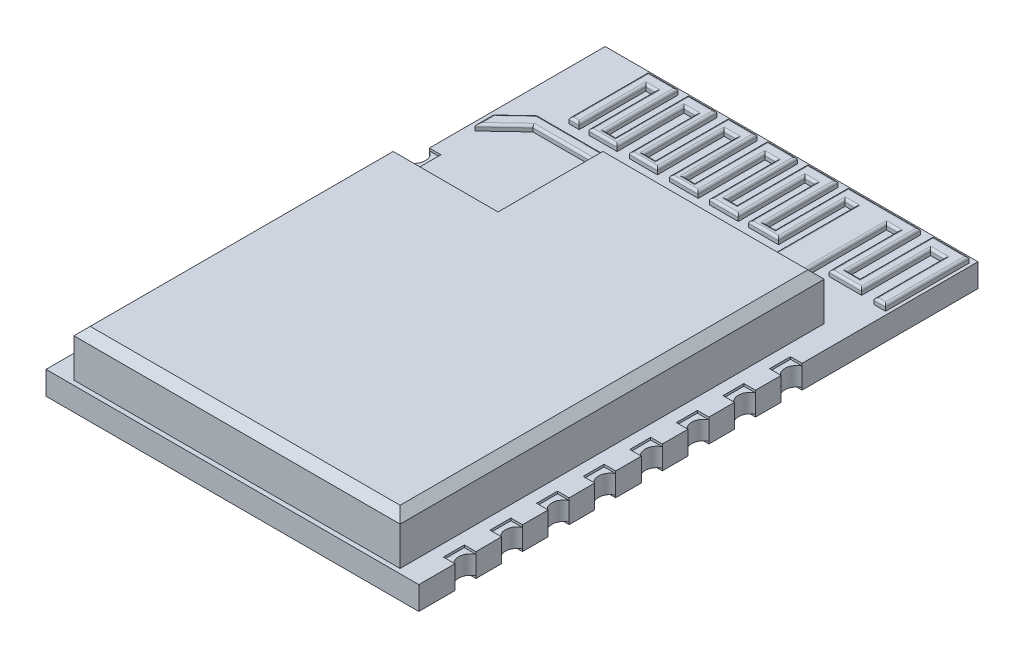
from build123d import *

# Parameters (mm, degrees)
EXTRUDE_1_DEPTH     = 1
CUT_EXTRUDE_1_DEPTH = 0.1
SKETCH_3_W          = 0.9999999999999991
SKETCH_3_H          = 0.9000000000000012
SKETCH_3_H_2        = 0.9000000000000021
SKETCH_3_W_2        = 1.0000000000000009
SKETCH_3_H_3        = 0.9000000000000017
SKETCH_3_H_4        = 0.9000000000000015
CUT_EXTRUDE_2_DEPTH = 0.1
CUT_EXTRUDE_3_DEPTH = 0.1
SKETCH_12_R         = 0.2
SKETCH_12_R_2       = 0.20000000000000023
SKETCH_12_R_3       = 0.1999999999999999
SKETCH_12_R_4       = 0.2000000000000001
SKETCH_12_R_5       = 0.19999999999999996
SKETCH_12_R_6       = 0.20000000000000007
CUT_EXTRUDE_4_DEPTH = 0.1
SKETCH_13_W         = 4.700000000000001
SKETCH_13_H         = 4.7
EXTRUDE_2_DEPTH     = 0.5
CUT_EXTRUDE_5_DEPTH = 0.1
SKETCH_16_R         = 0.2
SKETCH_16_R_2       = 0.19999999999999982
SKETCH_16_R_3       = 0.20000000000000004
SKETCH_16_R_4       = 0.19999999999999998
CUT_EXTRUDE_6_DEPTH = 0.25
EXTRUDE_4_DEPTH     = 2
CUT_EXTRUDE_7_DEPTH = 2
SKETCH_19_W         = 14
SKETCH_19_H         = 1.002469933908639
EXTRUDE_5_DEPTH     = 2
EXTRUDE_7_DEPTH     = 0.25
FILLET_4_R          = 0.1
CHAMFER_1_SIZE      = 0.35


with BuildPart() as part:
    # 草圖1 → 填料-伸長1 (new body)
    with BuildSketch(Plane(origin=(0, 0, 0), x_dir=(1, 0, 0), z_dir=(0, 1, 0))):
        Polygon((-8, 12.000000000000002), (8, 12.000000000000002), (8.000000000000004, -11.999999999999998), (-7.9999999999999964, -11.999999999999998), align=None)
    extrude(amount=EXTRUDE_1_DEPTH)

    # 草圖2 → 除料-伸長1 (cut)
    with BuildSketch(Plane(origin=(0, 1, 0), x_dir=(1, 0, 0), z_dir=(0, 1, 0))):
        Polygon((-7.999999999999998, 2.4499977713717627), (-7.999999999999998, 1.5499977713717676), (-7.502985717330638, 1.5499977713717659), (-7.502985717330638, 2.449997771371764), align=None)
        Polygon((-7.999999999999998, 0.44999777137176267), (-7.999999999999998, -0.45000222862823236), (-7.502985717330638, -0.4500022286282341), (-7.502985717330638, 0.44999777137176394), align=None)
        Polygon((-7.999999999999998, -1.5500022286282373), (-7.999999999999998, -2.4500022286282324), (-7.502985717330637, -2.450002228628234), (-7.502985717330637, -1.550002228628236), align=None)
        Polygon((-7.999999999999997, -3.5500022286282373), (-7.999999999999997, -4.450002228628234), (-7.502985717330637, -4.450002228628234), (-7.502985717330637, -3.550002228628236), align=None)
        Polygon((-7.999999999999997, -5.550002228628239), (-7.999999999999997, -6.450002228628234), (-7.502985717330637, -6.450002228628234), (-7.502985717330637, -5.5500022286282364), align=None)
        Polygon((-7.999999999999997, -7.550002228628239), (-7.999999999999997, -8.450002228628234), (-7.5029857173306365, -8.450002228628234), (-7.5029857173306365, -7.5500022286282364), align=None)
        Polygon((-7.5029857173306365, -9.550002228628236), (-7.9999999999999964, -9.550002228628237), (-7.9999999999999964, -10.450002228628234), (-7.5029857173306365, -10.450002228628234), align=None)
        Polygon((7.5029857173306365, -10.450002228628234), (8.000000000000004, -10.450002228628232), (8.000000000000004, -9.550002228628237), (7.5029857173306365, -9.550002228628236), align=None)
        Polygon((7.5029857173306365, -8.450002228628234), (8.000000000000004, -8.450002228628232), (8.000000000000004, -7.550002228628238), (7.5029857173306365, -7.5500022286282364), align=None)
        Polygon((7.502985717330636, -6.450002228628234), (8.000000000000004, -6.450002228628232), (8.000000000000002, -5.550002228628238), (7.502985717330636, -5.5500022286282364), align=None)
        Polygon((7.502985717330636, -4.450002228628234), (8.000000000000002, -4.450002228628232), (8.000000000000002, -3.5500022286282373), (7.502985717330636, -3.550002228628236), align=None)
        Polygon((7.502985717330636, -2.450002228628234), (8.000000000000002, -2.4500022286282324), (8.000000000000002, -1.5500022286282373), (7.502985717330636, -1.550002228628236), align=None)
        Polygon((7.502985717330635, -0.4500022286282341), (8.000000000000002, -0.45000222862823236), (8.000000000000002, 0.44999777137176267), (7.502985717330635, 0.44999777137176394), align=None)
        Polygon((7.502985717330635, 3.549997771371766), (8.000000000000002, 3.5499977713717676), (8.000000000000002, 4.449997771371764), (7.502985717330635, 4.449997771371764), align=None)
        Polygon((7.502985717330635, 1.5499977713717659), (8.000000000000002, 1.5499977713717676), (8.000000000000002, 2.4499977713717627), (7.502985717330635, 2.449997771371764), align=None)
        Polygon((-7.502985717330638, 4.449997771371764), (-7.502985717330638, 3.549997771371766), (-8.002985717330638, 3.5499977713717676), (-8.002985717330638, 4.449997771371763), align=None)
    extrude(amount=-CUT_EXTRUDE_1_DEPTH, mode=Mode.SUBTRACT)

    # 草圖3 → 除料-伸長2 (cut)
    with BuildSketch(Plane.XZ):
        with Locations((7.5000000000000036, 7.999999999999998)):
            Rectangle(SKETCH_3_W, SKETCH_3_H)
        with Locations((7.5000000000000036, 9.999999999999998)):
            Rectangle(SKETCH_3_W, SKETCH_3_H_2)
        with Locations((7.5000000000000036, 5.999999999999998)):
            Rectangle(SKETCH_3_W_2, SKETCH_3_H)
        with Locations((7.5000000000000036, 3.9999999999999982)):
            Rectangle(SKETCH_3_W_2, SKETCH_3_H_3)
        with Locations((7.500000000000002, 1.9999999999999982)):
            Rectangle(SKETCH_3_W, SKETCH_3_H)
        with Locations((7.500000000000002, -1.75e-15)):
            Rectangle(SKETCH_3_W, SKETCH_3_H_4)
        with Locations((7.500000000000002, -2.0000000000000018)):
            Rectangle(SKETCH_3_W, SKETCH_3_H)
        with Locations((7.500000000000002, -4.000000000000002)):
            Rectangle(SKETCH_3_W, SKETCH_3_H_2)
        with Locations((-7.5000000000000036, 9.999999999999998)):
            Rectangle(SKETCH_3_W, SKETCH_3_H_2)
        with Locations((-7.500000000000002, -4.000000000000002)):
            Rectangle(SKETCH_3_W, SKETCH_3_H_2)
        with Locations((-7.500000000000002, -2.0000000000000018)):
            Rectangle(SKETCH_3_W, SKETCH_3_H)
        with Locations((-7.500000000000002, -1.75e-15)):
            Rectangle(SKETCH_3_W, SKETCH_3_H_4)
        with Locations((-7.500000000000002, 1.9999999999999982)):
            Rectangle(SKETCH_3_W, SKETCH_3_H)
        with Locations((-7.5000000000000036, 3.9999999999999982)):
            Rectangle(SKETCH_3_W_2, SKETCH_3_H_3)
        with Locations((-7.5000000000000036, 5.999999999999998)):
            Rectangle(SKETCH_3_W_2, SKETCH_3_H)
        with Locations((-7.5000000000000036, 7.999999999999998)):
            Rectangle(SKETCH_3_W, SKETCH_3_H)
    extrude(amount=-CUT_EXTRUDE_2_DEPTH, mode=Mode.SUBTRACT)

    # 草圖8 → 除料-伸長3 (cut)
    with BuildSketch(Plane(origin=(0, 1, 0), x_dir=(1, 0, 0), z_dir=(0, 1, 0))):
        Polygon((-0.9999999999999989, 0.6000000000000024), (3.7000000000000015, 0.6000000000000024), (3.700000000000002, -4.099999999999998), (-0.9999999999999983, -4.099999999999998), align=None)
    extrude(amount=-CUT_EXTRUDE_3_DEPTH, mode=Mode.SUBTRACT)

    # 草圖12 → 除料-伸長4 (cut)
    with BuildSketch(Plane(origin=(0, 0.9, 0), x_dir=(1, 0, 0), z_dir=(0, 1, 0))):
        with Locations(Location((-0.5099999999999989, -3.6499999999999977, 0), (0, 0, 270))):
            Circle(SKETCH_12_R)
        with Locations(Location((0.4200000000000011, -3.6499999999999977, 0), (0, 0, 270))):
            Circle(SKETCH_12_R)
        with Locations(Location((1.3500000000000012, -3.6499999999999977, 0), (0, 0, 270))):
            Circle(SKETCH_12_R)
        with Locations(Location((2.2800000000000007, -3.6499999999999977, 0), (0, 0, 270))):
            Circle(SKETCH_12_R_2)
        with Locations(Location((3.210000000000001, -3.6499999999999977, 0), (0, 0, 270))):
            Circle(SKETCH_12_R_2)
        with Locations(Location((-0.509999999999999, -2.7199999999999975, 0), (0, 0, 270))):
            Circle(SKETCH_12_R_3)
        with Locations(Location((0.420000000000001, -2.7199999999999975, 0), (0, 0, 270))):
            Circle(SKETCH_12_R_3)
        with Locations(Location((1.350000000000001, -2.7199999999999975, 0), (0, 0, 270))):
            Circle(SKETCH_12_R_3)
        with Locations(Location((2.2800000000000007, -2.7199999999999975, 0), (0, 0, 270))):
            Circle(SKETCH_12_R_4)
        with Locations(Location((3.210000000000001, -2.7199999999999975, 0), (0, 0, 270))):
            Circle(SKETCH_12_R_4)
        with Locations(Location((-0.5099999999999991, -1.7899999999999978, 0), (0, 0, 270))):
            Circle(SKETCH_12_R_5)
        with Locations(Location((0.4200000000000008, -1.7899999999999978, 0), (0, 0, 270))):
            Circle(SKETCH_12_R_6)
        with Locations(Location((1.350000000000001, -1.7899999999999978, 0), (0, 0, 270))):
            Circle(SKETCH_12_R)
        with Locations(Location((2.2800000000000002, -1.7899999999999978, 0), (0, 0, 270))):
            Circle(SKETCH_12_R_2)
        with Locations(Location((3.2100000000000004, -1.7899999999999978, 0), (0, 0, 270))):
            Circle(SKETCH_12_R_2)
        with Locations(Location((-0.5099999999999993, -0.8599999999999979, 0), (0, 0, 270))):
            Circle(SKETCH_12_R_6)
        with Locations(Location((0.4200000000000007, -0.8599999999999979, 0), (0, 0, 270))):
            Circle(SKETCH_12_R_5)
        with Locations(Location((1.3500000000000008, -0.8599999999999979, 0), (0, 0, 270))):
            Circle(SKETCH_12_R)
        with Locations(Location((2.2800000000000002, -0.8599999999999979, 0), (0, 0, 270))):
            Circle(SKETCH_12_R_2)
        with Locations(Location((3.2100000000000004, -0.8599999999999979, 0), (0, 0, 270))):
            Circle(SKETCH_12_R_2)
        with Locations(Location((-0.5099999999999995, 0.07000000000000235, 0), (0, 0, 270))):
            Circle(SKETCH_12_R_6)
        with Locations(Location((0.4200000000000006, 0.07000000000000235, 0), (0, 0, 270))):
            Circle(SKETCH_12_R_5)
        with Locations(Location((1.3500000000000008, 0.07000000000000235, 0), (0, 0, 270))):
            Circle(SKETCH_12_R)
        with Locations(Location((2.2800000000000002, 0.07000000000000235, 0), (0, 0, 270))):
            Circle(SKETCH_12_R_2)
        with Locations(Location((3.2100000000000004, 0.07000000000000235, 0), (0, 0, 270))):
            Circle(SKETCH_12_R_2)
    extrude(amount=-CUT_EXTRUDE_4_DEPTH, mode=Mode.SUBTRACT)

    # 草圖13 → 填料-伸長2 (add)
    with BuildSketch(Plane(origin=(0, 1, 0), x_dir=(1, 0, 0), z_dir=(0, 1, 0))):
        with Locations((1.3500000000000016, -1.7499999999999978)):
            Rectangle(SKETCH_13_W, SKETCH_13_H)
    extrude(amount=-EXTRUDE_2_DEPTH)

    # 草圖15 → 除料-伸長5 (cut)
    with BuildSketch(Plane.XZ):
        Polygon((1.0000000000000018, -0.6000000000000014), (-3.6999999999999984, -0.6000000000000021), (-3.6999999999999984, 4.099999999999997), (1.000000000000002, 4.099999999999998), align=None)
    extrude(amount=-CUT_EXTRUDE_5_DEPTH, mode=Mode.SUBTRACT)

    # 草圖16 → 除料-伸長6 (cut)
    with BuildSketch(Plane.XZ):
        with Locations(Location((0.5100000000000018, 3.6099999999999977, 0), (0, 0, 270))):
            Circle(SKETCH_16_R)
        with Locations(Location((-0.41999999999999826, 3.6099999999999977, 0), (0, 0, 270))):
            Circle(SKETCH_16_R)
        with Locations(Location((-1.3499999999999983, 3.609999999999997, 0), (0, 0, 270))):
            Circle(SKETCH_16_R)
        with Locations(Location((-2.279999999999998, 3.609999999999997, 0), (0, 0, 270))):
            Circle(SKETCH_16_R_2)
        with Locations(Location((-3.2099999999999986, 3.6099999999999968, 0), (0, 0, 270))):
            Circle(SKETCH_16_R_2)
        with Locations(Location((-3.2099999999999986, 2.679999999999997, 0), (0, 0, 270))):
            Circle(SKETCH_16_R_2)
        with Locations(Location((-2.279999999999998, 2.6799999999999975, 0), (0, 0, 270))):
            Circle(SKETCH_16_R_2)
        with Locations(Location((-1.3499999999999983, 2.6799999999999975, 0), (0, 0, 270))):
            Circle(SKETCH_16_R)
        with Locations(Location((-0.4199999999999983, 2.679999999999998, 0), (0, 0, 270))):
            Circle(SKETCH_16_R)
        with Locations(Location((0.5100000000000018, 2.679999999999998, 0), (0, 0, 270))):
            Circle(SKETCH_16_R)
        with Locations(Location((-3.2099999999999986, 1.749999999999997, 0), (0, 0, 270))):
            Circle(SKETCH_16_R_2)
        with Locations(Location((-2.279999999999998, 1.7499999999999973, 0), (0, 0, 270))):
            Circle(SKETCH_16_R_2)
        with Locations(Location((-1.3499999999999983, 1.7499999999999973, 0), (0, 0, 270))):
            Circle(SKETCH_16_R)
        with Locations(Location((-0.4199999999999984, 1.7499999999999978, 0), (0, 0, 270))):
            Circle(SKETCH_16_R_3)
        with Locations(Location((0.5100000000000017, 1.7499999999999978, 0), (0, 0, 270))):
            Circle(SKETCH_16_R)
        with Locations(Location((-3.2099999999999986, 0.819999999999997, 0), (0, 0, 270))):
            Circle(SKETCH_16_R_2)
        with Locations(Location((-2.279999999999998, 0.8199999999999974, 0), (0, 0, 270))):
            Circle(SKETCH_16_R_2)
        with Locations(Location((-1.3499999999999985, 0.8199999999999974, 0), (0, 0, 270))):
            Circle(SKETCH_16_R)
        with Locations(Location((-0.4199999999999984, 0.8199999999999978, 0), (0, 0, 270))):
            Circle(SKETCH_16_R_4)
        with Locations(Location((0.5100000000000017, 0.8199999999999978, 0), (0, 0, 270))):
            Circle(SKETCH_16_R)
        with Locations(Location((-3.2099999999999986, -0.11000000000000289, 0), (0, 0, 270))):
            Circle(SKETCH_16_R_2)
        with Locations(Location((-2.279999999999998, -0.11000000000000246, 0), (0, 0, 270))):
            Circle(SKETCH_16_R_2)
        with Locations(Location((-1.3499999999999985, -0.11000000000000246, 0), (0, 0, 270))):
            Circle(SKETCH_16_R)
        with Locations(Location((-0.41999999999999843, -0.11000000000000203, 0), (0, 0, 270))):
            Circle(SKETCH_16_R)
        with Locations(Location((0.5100000000000016, -0.11000000000000203, 0), (0, 0, 270))):
            Circle(SKETCH_16_R)
    extrude(amount=-CUT_EXTRUDE_6_DEPTH, mode=Mode.SUBTRACT)

    # 草圖17 → 填料-伸長4 (add)
    with BuildSketch(Plane(origin=(0, 1, 0), x_dir=(1, 0, 0), z_dir=(0, 1, 0))):
        Polygon((-2.500000000000001, 6.400000000000003), (7.000000000000003, 6.400000000000002), (7.000000000000003, -10.799999999999999), (-6.999999999999997, -10.799999999999999), (-6.999999999999999, 1.400000000000001), (-6.999999999999999, 1.9000000000000024), (-2.5000000000000004, 1.9000000000000032), align=None)
    extrude(amount=EXTRUDE_4_DEPTH)

    # 草圖18 → 除料-伸長7 (cut)
    with BuildSketch(Plane(origin=(0, 1, 0), x_dir=(1, 0, 0), z_dir=(0, 1, 0))):
        with BuildLine():
            Line((-8, 4.449997771371763), (-7.999999999999998, 3.549997771371766))
            ThreePointArc((-7.999999999999998, 3.549997771371766), (-7.717944947177037, 3.999997771371765), (-8, 4.449997771371763))
        make_face()
        with BuildLine():
            Line((-8, 2.4499977713717622), (-7.999999999999998, 1.5499977713717659))
            ThreePointArc((-7.999999999999998, 1.5499977713717659), (-7.717944947177038, 1.999997771371765), (-8, 2.4499977713717622))
        make_face()
        with BuildLine():
            Line((-8, 0.4499977713717622), (-7.999999999999998, -0.4500022286282341))
            ThreePointArc((-7.999999999999998, -0.4500022286282341), (-7.717944947177038, -2.22862823506e-06), (-8, 0.4499977713717622))
        make_face()
        with BuildLine():
            Line((-8, -1.5500022286282378), (-7.999999999999998, -2.450002228628234))
            ThreePointArc((-7.999999999999998, -2.450002228628234), (-7.717944947177037, -2.0000022286282353), (-8, -1.5500022286282378))
        make_face()
        with BuildLine():
            Line((-8, -3.5500022286282378), (-7.999999999999998, -4.450002228628234))
            ThreePointArc((-7.999999999999998, -4.450002228628234), (-7.717944947177038, -4.000002228628235), (-8, -3.5500022286282378))
        make_face()
        with BuildLine():
            Line((-8, -5.550002228628238), (-7.999999999999998, -6.450002228628234))
            ThreePointArc((-7.999999999999998, -6.450002228628234), (-7.717944947177038, -6.000002228628235), (-8, -5.550002228628238))
        make_face()
        with BuildLine():
            Line((-8, -7.550002228628238), (-7.999999999999998, -8.450002228628234))
            ThreePointArc((-7.999999999999998, -8.450002228628234), (-7.717944947177037, -8.000002228628235), (-8, -7.550002228628238))
        make_face()
        with BuildLine():
            Line((-8, -9.550002228628237), (-7.999999999999998, -10.450002228628234))
            ThreePointArc((-7.999999999999998, -10.450002228628234), (-7.717944947177038, -10.000002228628235), (-8, -9.550002228628237))
        make_face()
        with BuildLine():
            Line((8, 4.449997771371763), (7.999999999999998, 3.549997771371766))
            ThreePointArc((7.999999999999998, 3.549997771371766), (7.717944947177037, 3.999997771371765), (8, 4.449997771371763))
        make_face()
        with BuildLine():
            Line((8, 2.4499977713717622), (7.999999999999998, 1.5499977713717659))
            ThreePointArc((7.999999999999998, 1.5499977713717659), (7.717944947177038, 1.999997771371765), (8, 2.4499977713717622))
        make_face()
        with BuildLine():
            Line((8, 0.4499977713717622), (7.999999999999998, -0.4500022286282341))
            ThreePointArc((7.999999999999998, -0.4500022286282341), (7.717944947177038, -2.228628235e-06), (8, 0.4499977713717622))
        make_face()
        with BuildLine():
            Line((8, -1.5500022286282378), (7.999999999999998, -2.450002228628234))
            ThreePointArc((7.999999999999998, -2.450002228628234), (7.717944947177037, -2.0000022286282353), (8, -1.5500022286282378))
        make_face()
        with BuildLine():
            Line((8, -3.5500022286282378), (7.999999999999998, -4.450002228628234))
            ThreePointArc((7.999999999999998, -4.450002228628234), (7.717944947177038, -4.000002228628235), (8, -3.5500022286282378))
        make_face()
        with BuildLine():
            Line((8, -5.550002228628238), (7.999999999999998, -6.450002228628234))
            ThreePointArc((7.999999999999998, -6.450002228628234), (7.717944947177038, -6.000002228628235), (8, -5.550002228628238))
        make_face()
        with BuildLine():
            Line((8, -7.550002228628238), (7.999999999999998, -8.450002228628234))
            ThreePointArc((7.999999999999998, -8.450002228628234), (7.717944947177037, -8.000002228628235), (8, -7.550002228628238))
        make_face()
        with BuildLine():
            Line((8, -9.550002228628237), (7.999999999999998, -10.450002228628234))
            ThreePointArc((7.999999999999998, -10.450002228628234), (7.717944947177038, -10.000002228628235), (8, -9.550002228628237))
        make_face()
    extrude(amount=-CUT_EXTRUDE_7_DEPTH, mode=Mode.SUBTRACT)

    # 草圖19 → 填料-伸長5 (add)
    with BuildSketch(Plane(origin=(0, 1, 0), x_dir=(1, 0, 0), z_dir=(0, 1, 0))):
        with Locations((2.22e-15, -11.301234966954318)):
            Rectangle(SKETCH_19_W, SKETCH_19_H)
    extrude(amount=EXTRUDE_5_DEPTH)

    # 草圖20 → 填料-伸長7 (add)
    with BuildSketch(Plane(origin=(0, 1, 0), x_dir=(1, 0, 0), z_dir=(0, 1, 0))):
        Polygon((2.7745772280204366, 7.299411594104662), (2.774577228020436, 6.400000000000003), (2.2500000000000013, 6.400000000000003), (2.2333276157297033, 7.273314493037537), (-6.374311063944464, 7.2733144930375415), (-7.5709253757125925, 6.142787441828224), (-7.65515008486728, 6.06321434033413), (-7.65515008486728, 6.074907724951117), (-7.65515008486728, 6.142787441828224), (-7.65515008486728, 6.849705797052333), (-6.687394800885329, 7.764013370288473), (3.5229671278681067, 7.7640133702884695), (3.5229671278681067, 11.214195737954471), (3.088020932820037, 11.214195737954471), (3.088020932820037, 8.351190733603364), (1.8049296574282336, 8.351190733603364), (1.8049296574282336, 11.214195737954471), (1.359109807503962, 11.214195737954471), (1.359109807503962, 8.351190733603364), (0.11951315161696369, 8.351190733603364), (0.11951315161696369, 11.214195737954471), (-0.35892766293591294, 11.214195737954471), (-0.35892766293591294, 8.351190733603364), (-1.5876506639467096, 8.351190733603364), (-1.5876506639467096, 11.214195737954471), (-2.109586098004393, 11.214195737954471), (-2.109586098004393, 8.351190733603364), (-3.3165617892627863, 8.351190733603364), (-3.3165617892627863, 11.214195737954471), (-3.8384972233204695, 11.214195737954471), (-3.8384972233204695, 8.351190733603364), (-5.056346569455065, 8.351190733603364), (-5.056346569455065, 11.214195737954471), (-5.4695454547507305, 11.214195737954471), (-5.4695454547507305, 8.351190733603364), (-5.904491649798801, 8.351190733603364), (-5.904491649798801, 11.75561570856587), (-4.632274029283196, 11.75561570856587), (-4.632274029283196, 8.628639143606161), (-4.185197948571669, 8.628639143606161), (-4.185197948571669, 11.75561570856587), (-2.9587159743295213, 11.75561570856587), (-2.9587159743295213, 8.628639143606161), (-2.4725429394947964, 8.628639143606161), (-2.4725429394947964, 11.75561570856587), (-1.235011578097315, 11.75561570856587), (-1.235011578097315, 8.628639143606161), (-0.7819867047285942, 8.628639143606161), (-0.7819867047285942, 11.75561570856587), (0.4886928181348912, 11.75561570856587), (0.4886928181348912, 8.728083628004175), (0.9417176915036121, 8.728083628004175), (0.9417176915036121, 11.75561570856587), (2.2344959886777684, 11.75561570856587), (2.2344959886777684, 8.628639143606161), (2.6764714748911547, 8.628639143606161), (2.6764714748911547, 11.75561570856587), (5.770299878384859, 11.75561570856587), (5.770299878384859, 8.628639143606161), (5.858694975627536, 8.628639143606161), (6.3117198489962565, 8.628639143606161), (6.3117198489962565, 11.75561570856587), (7.8586340507431105, 11.75561570856587), (7.8586340507431105, 8.17561427023744), (7.350362241597716, 8.17561427023744), (7.350362241597716, 11.214195737954471), (6.7536953352096445, 11.214195737954471), (6.7536953352096445, 8.252959980324784), (5.361472553637476, 8.252959980324784), (5.361472553637476, 11.214195737954471), (4.855655638179534, 11.214195737954471), (4.855655638179534, 7.299411594104662), align=None)
    extrude(amount=EXTRUDE_7_DEPTH)

    # 圓角4
    fillet_4_edges = [part.edges().sort_by_distance(p)[0] for p in [
        (-7.014730574405872, 1.25, -6.668264416685836),
        (2.2500000000000013, 1.125, -6.400000000000003),
        (2.7745772280204366, 1.25, -6.849705797052332),
        (2.774577228020436, 1.125, -6.400000000000003),
        (3.5229671278681067, 1.25, -9.48910455412147),
        (-1.5822138365086111, 1.25, -7.764013370288471),
        (-7.171272442876305, 1.25, -7.306859583670403),
        (-7.65515008486728, 1.25, -6.456460068693231),
        (-2.0704917241073804, 1.25, -7.273314493037539),
        (2.2416638078648523, 1.25, -6.8366572465187705),
        (2.5122886140102185, 1.25, -6.400000000000003),
        (3.815116433099985, 1.25, -7.299411594104662),
        (4.855655638179534, 1.25, -9.256803666029565),
        (5.1085640959085055, 1.25, -11.214195737954471),
        (5.361472553637476, 1.25, -9.733577859139627),
        (6.057583944423561, 1.25, -8.252959980324784),
        (6.7536953352096445, 1.25, -9.733577859139627),
        (7.05202878840368, 1.25, -11.214195737954471),
        (7.350362241597716, 1.25, -9.694905004095956),
        (7.604498146170413, 1.25, -8.17561427023744),
        (7.8586340507431105, 1.25, -9.965614989401654),
        (7.085176949869684, 1.25, -11.75561570856587),
        (6.3117198489962565, 1.25, -10.192127426086016),
        (6.041009863690558, 1.25, -8.628639143606161),
        (5.770299878384859, 1.25, -10.192127426086016),
        (4.2233856766380065, 1.25, -11.75561570856587),
        (2.6764714748911547, 1.25, -10.192127426086016),
        (2.4554837317844616, 1.25, -8.628639143606161),
        (2.2344959886777684, 1.25, -10.192127426086016),
        (1.5881068400906901, 1.25, -11.75561570856587),
        (0.9417176915036121, 1.25, -10.241849668285022),
        (0.7152052548192516, 1.25, -8.728083628004175),
        (0.4886928181348912, 1.25, -10.241849668285022),
        (-0.14664694329685157, 1.25, -11.75561570856587),
        (-0.7819867047285942, 1.25, -10.192127426086016),
        (-1.0084991414129547, 1.25, -8.628639143606161),
        (-1.235011578097315, 1.25, -10.192127426086016),
        (-1.8537772587960557, 1.25, -11.75561570856587),
        (-2.4725429394947964, 1.25, -10.192127426086016),
        (-2.7156294569121586, 1.25, -8.628639143606161),
        (-2.9587159743295213, 1.25, -10.192127426086016),
        (-3.571956961450595, 1.25, -11.75561570856587),
        (-4.185197948571669, 1.25, -10.192127426086016),
        (-4.4087359889274325, 1.25, -8.628639143606161),
        (-4.632274029283196, 1.25, -10.192127426086016),
        (-5.268382839540998, 1.25, -11.75561570856587),
        (-5.904491649798801, 1.25, -10.053403221084617),
        (-5.687018552274766, 1.25, -8.351190733603364),
        (-5.4695454547507305, 1.25, -9.782693235778918),
        (-5.262946012102898, 1.25, -11.214195737954471),
        (-5.056346569455065, 1.25, -9.782693235778918),
        (-4.447421896387767, 1.25, -8.351190733603364),
        (-3.8384972233204695, 1.25, -9.782693235778918),
        (-3.577529506291628, 1.25, -11.214195737954471),
        (-3.3165617892627863, 1.25, -9.782693235778918),
        (-2.7130739436335896, 1.25, -8.351190733603364),
        (-2.109586098004393, 1.25, -9.782693235778918),
        (-1.8486183809755512, 1.25, -11.214195737954471),
        (-1.5876506639467096, 1.25, -9.782693235778918),
        (-0.9732891634413113, 1.25, -8.351190733603364),
        (-0.35892766293591294, 1.25, -9.782693235778918),
        (-0.11970725565947463, 1.25, -11.214195737954471),
        (0.11951315161696369, 1.25, -9.782693235778918),
        (0.7393114795604628, 1.25, -8.351190733603364),
        (1.359109807503962, 1.25, -9.782693235778918),
        (1.5820197324660978, 1.25, -11.214195737954471),
        (1.8049296574282336, 1.25, -9.782693235778918),
        (2.4464752951241353, 1.25, -8.351190733603364),
        (3.088020932820037, 1.25, -9.782693235778918),
        (3.3054940303440716, 1.25, -11.214195737954471),
    ]]
    fillet(fillet_4_edges, radius=FILLET_4_R)

    # 導角1
    chamfer_1_edges = [part.edges().sort_by_distance(p)[0] for p in [
        (7.000000000000003, 3, 2.701234966954317),
        (2.250000000000001, 3, -6.400000000000002),
        (-2.500000000000001, 3, -4.150000000000003),
        (-4.75, 3, -1.9000000000000028),
        (-6.999999999999998, 3, 4.951234966954317),
        (2.66e-15, 3, 11.802469933908636),
    ]]
    chamfer(chamfer_1_edges, length=CHAMFER_1_SIZE)


solid = part.part
